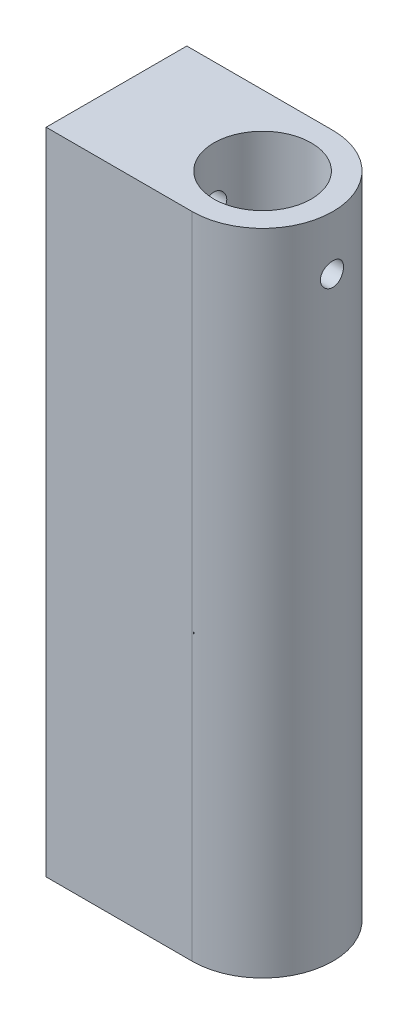
from build123d import *

# Parameters (mm, degrees)
SKETCH1_R             = 5.715
BOSS_EXTRUDE1_DEPTH   = 76.2
SKETCH4_R             = 5.715
SKETCH4_R_2           = 5.08
BOSS_EXTRUDE2_DEPTH   = 3.81
F_6_32_TAPPED_HOLE1_D = 2.7051


with BuildPart() as part:
    # Sketch1 → Boss-Extrude1 (new body)
    with BuildSketch(Plane(origin=(0, 0, 0), x_dir=(1, 0, 0), z_dir=(0, 1, 0))):
        with BuildLine():
            Line((0, 8.255), (-17.145, 8.255))
            Line((-17.145, 8.255), (-17.145, -8.255))
            Line((-17.145, -8.255), (0, -8.255))
            ThreePointArc((0, -8.255), (8.255, 0), (0, 8.255))
        make_face()
        Circle(SKETCH1_R, mode=Mode.SUBTRACT)
    extrude(amount=BOSS_EXTRUDE1_DEPTH)

    # Sketch4 → Boss-Extrude2 (add)
    with BuildSketch(Plane.XZ):
        Circle(SKETCH4_R)
        Circle(SKETCH4_R_2, mode=Mode.SUBTRACT)
    extrude(amount=-BOSS_EXTRUDE2_DEPTH)

    # #6-32 Tapped Hole1 (through all)
    with Locations(Plane.ZY.offset(17.145)):
        with Locations((0, 69.85)):
            Hole(F_6_32_TAPPED_HOLE1_D / 2)


solid = part.part
